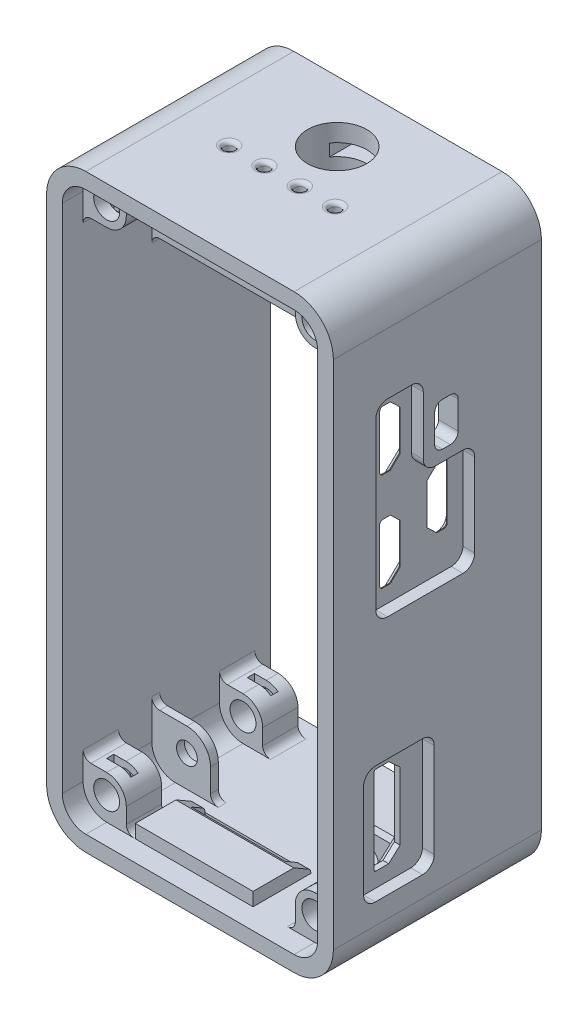
from build123d import *

# Parameters (mm, degrees)
SKETCH1_W               = 31.45
SKETCH1_H               = 73.12
BOSS_EXTRUDE1_DEPTH     = 2
SKETCH3_W               = 31.45
SKETCH3_H               = 73.12
BOSS_EXTRUDE2_DEPTH     = 2
SKETCH4_W               = 36.53
SKETCH4_H               = 31.45
BOSS_EXTRUDE3_DEPTH     = 2
SKETCH5_W               = 36.53
SKETCH5_H               = 31.45
BOSS_EXTRUDE4_DEPTH     = 2
FILLET1_R               = 3
FILLET2_R               = 5
CUT_EXTRUDE1_DEPTH      = 4
CUT_EXTRUDE2_DEPTH      = 1.5
BOSS_EXTRUDE5_DEPTH     = 0.5
BOSS_EXTRUDE6_DEPTH     = 1.13
CHAMFER1_SIZE           = 0.9
SKETCH10_W              = 12
SKETCH10_H              = 1.740840386
CUT_EXTRUDE3_DEPTH      = 3
BOSS_EXTRUDE7_DEPTH     = 1.7
CUT_REVOLVE1_ANGLE      = 90
FILLET4_R               = 0.5
CUT_EXTRUDE4_REACH      = 81.694
SKETCH14_R              = 0.65
FILLET5_R               = 0.5
BOSS_EXTRUDE8_START     = 1
SKETCH16_R              = 1.325
BOSS_EXTRUDE8_DEPTH     = 1
BOSS_EXTRUDE9_DEPTH     = 0.7
SKETCH18_W              = 1.3
SKETCH18_H              = 9.62
CUT_EXTRUDE5_DEPTH      = 1.05
FILLET6_R               = 1
BOSS_EXTRUDE10_START    = 12.119658
BOSS_EXTRUDE10_DEPTH    = 12.119658
CUT_EXTRUDE6_REACH      = 81.694
SKETCH19_R              = 3.770921471
CHAMFER2_SIZE           = 0.5
CUT_EXTRUDE7_REACH      = 53.007
CUT_EXTRUDE7_END_RADIUS = 3.770921471
SKETCH22_W              = 6.22384006
SKETCH22_H              = 1.541488546
SKETCH23_W              = 1.3
SKETCH23_H              = 0.25
CUT_EXTRUDE8_DEPTH      = 5.42
CUT_EXTRUDE9_START      = -4
CUT_EXTRUDE9_DEPTH      = 4
BOSS_EXTRUDE11_DEPTH    = 4.5
FILLET7_R               = 1
SKETCH26_R              = 1.65
CUT_EXTRUDE10_DEPTH     = 4.5
SKETCH27_R              = 1.25
CUT_EXTRUDE11_DEPTH     = 9.319658174
SKETCH28_W              = 3
SKETCH28_H              = 0.918176765
CUT_EXTRUDE12_DEPTH     = 2.5
SKETCH29_W              = 3
SKETCH29_H              = 0.918176765
CUT_EXTRUDE13_DEPTH     = 2.5
CUT_EXTRUDE16_START     = -0.95
CUT_EXTRUDE16_DEPTH     = 0.95
BOSS_EXTRUDE12_START    = 4.5
BOSS_EXTRUDE12_DEPTH    = 4.5
SKETCH32_R              = 1.65
CUT_EXTRUDE17_DEPTH     = 4.5
FILLET8_R               = 1
SKETCH33_W              = 3.09328516
SKETCH33_H              = 0.918176764
CUT_EXTRUDE18_DEPTH     = 2.5
CUT_EXTRUDE19_REACH     = 73.721
SKETCH34_W              = 0.67664258
SKETCH34_H              = 0.918176764
SKETCH35_W              = 3.09328516
SKETCH35_H              = 0.918176764
CUT_EXTRUDE20_DEPTH     = 2.5
CUT_EXTRUDE21_REACH     = 73.796
SKETCH36_W              = 8.9
SKETCH36_H              = 6.619658174
SKETCH37_W              = 15
SKETCH37_H              = 1.7
BOSS_EXTRUDE13_DEPTH    = 1.609159614
CHAMFER3_SIZE           = 1.25
CHAMFER3_SIZE2          = 2.165063509
FILLET9_R               = 0.5


with BuildPart() as part:
    # Sketch1 → Boss-Extrude1 (new body)
    with BuildSketch(Plane(origin=(16.53, 0, 0), x_dir=(0, 0, -1), z_dir=(1, 0, 0))):
        with Locations((3.375, 1.56)):
            Rectangle(SKETCH1_W, SKETCH1_H)
    extrude(amount=BOSS_EXTRUDE1_DEPTH)



with BuildPart() as body_2:
    # Sketch3 → Boss-Extrude2 (new body)
    with BuildSketch(Plane.ZY.offset(16)):
        with Locations((-3.375, 1.56)):
            Rectangle(SKETCH3_W, SKETCH3_H)
    extrude(amount=BOSS_EXTRUDE2_DEPTH)


with BuildPart() as part_1:
    add(part.part)

    add(body_2.part)  # Boss-Extrude3 merges body 2
    # Sketch4 → Boss-Extrude3 (add)
    with BuildSketch(Plane(origin=(0, 38.12, 0), x_dir=(1, 0, 0), z_dir=(0, 1, 0))):
        with Locations((0.265, 3.375)):
            Rectangle(SKETCH4_W, SKETCH4_H)
    extrude(amount=BOSS_EXTRUDE3_DEPTH)

    # Sketch5 → Boss-Extrude4 (add)
    with BuildSketch(Plane.XZ.offset(35)):
        with Locations((0.265, -3.375)):
            Rectangle(SKETCH5_W, SKETCH5_H)
    extrude(amount=-BOSS_EXTRUDE4_DEPTH)

    # Fillet1
    fillet1_edges = [part_1.edges().sort_by_distance(p)[0] for p in [
        (-16, 38.12, -3.375),
        (-16, -33, -3.375),
        (16.53, -33, -3.375),
        (16.53, 38.12, -3.375),
    ]]
    fillet(fillet1_edges, radius=FILLET1_R)

    # Fillet2
    fillet2_edges = [part_1.edges().sort_by_distance(p)[0] for p in [
        (-18, 40.12, -3.375),
        (18.53, 40.12, -3.375),
        (-18, -35, -3.375),
        (18.53, -35, -3.375),
    ]]
    fillet(fillet2_edges, radius=FILLET2_R)

    # Sketch6 → Cut-Extrude1 (cut)
    with BuildSketch(Plane(origin=(18.53, 0, 0), x_dir=(0, 0, -1), z_dir=(1, 0, 0))):
        with BuildLine():
            Line((-4, 24.95), (-4, 18.2))
            ThreePointArc((-4, 18.2), (-3.882842712, 17.917157288), (-3.6, 17.8))
            Line((-3.6, 17.8), (-2.65, 17.8))
            Line((-2.65, 17.8), (-1.4, 19))
            Line((-1.4, 19), (-1.4, 24.15))
            Line((-1.4, 24.15), (-2.65, 25.35))
            Line((-2.65, 25.35), (-3.6, 25.35))
            ThreePointArc((-3.6, 25.35), (-3.882842712, 25.232842712), (-4, 24.95))
        make_face()
        with BuildLine():
            Line((-3.6, 5.3), (-2.65, 5.3))
            Line((-2.65, 5.3), (-1.4, 6.5))
            Line((-1.4, 6.5), (-1.4, 11.65))
            Line((-1.4, 11.65), (-2.65, 12.85))
            Line((-2.65, 12.85), (-3.6, 12.85))
            ThreePointArc((-3.6, 12.85), (-3.882842712, 12.732842712), (-4, 12.45))
            Line((-4, 12.45), (-4, 5.7))
            ThreePointArc((-4, 5.7), (-3.882842712, 5.417157288), (-3.6, 5.3))
        make_face()
        with BuildLine():
            Line((4.2, 15.5), (3.25, 15.5))
            Line((3.25, 15.5), (2, 14.3))
            Line((2, 14.3), (2, 9.15))
            Line((2, 9.15), (3.25, 7.95))
            Line((3.25, 7.95), (4.2, 7.95))
            ThreePointArc((4.2, 7.95), (4.482842712, 8.067157288), (4.6, 8.35))
            Line((4.6, 8.35), (4.6, 15.1))
            ThreePointArc((4.6, 15.1), (4.482842712, 15.382842712), (4.2, 15.5))
        make_face()
        with BuildLine():
            Line((-2.85, -14.25), (-4.5, -14.25))
            ThreePointArc((-4.5, -14.25), (-4.641421356, -14.308578644), (-4.7, -14.45))
            Line((-4.7, -14.45), (-4.7, -25.3))
            ThreePointArc((-4.7, -25.3), (-4.641421356, -25.441421356), (-4.5, -25.5))
            Line((-4.5, -25.5), (-2.85, -25.5))
            Line((-2.85, -25.5), (-1.4, -24.175))
            Line((-1.4, -24.175), (-1.4, -15.575))
            Line((-1.4, -15.575), (-2.85, -14.25))
        make_face()
        with BuildLine():
            Line((1.5, 22.8), (1.5, 19.3))
            ThreePointArc((1.5, 19.3), (1.792893219, 18.592893219), (2.5, 18.3))
            Line((2.5, 18.3), (3.5, 18.3))
            ThreePointArc((3.5, 18.3), (4.207106781, 18.592893219), (4.5, 19.3))
            Line((4.5, 19.3), (4.5, 22.8))
            ThreePointArc((4.5, 22.8), (4.207106781, 23.507106781), (3.5, 23.8))
            Line((3.5, 23.8), (2.5, 23.8))
            ThreePointArc((2.5, 23.8), (1.792893219, 23.507106781), (1.5, 22.8))
        make_face()
    extrude(amount=-CUT_EXTRUDE1_DEPTH, mode=Mode.SUBTRACT)

    # Sketch7 → Cut-Extrude2 (cut)
    with BuildSketch(Plane(origin=(18.53, 0, 0), x_dir=(0, 0, -1), z_dir=(1, 0, 0))):
        with BuildLine():
            Line((0.05, 25.85), (0.05, 18.4))
            ThreePointArc((0.05, 18.4), (0.489339828, 17.339339828), (1.55, 16.9))
            Line((1.55, 16.9), (5.1, 16.9))
            ThreePointArc((5.1, 16.9), (6.160660172, 16.460660172), (6.6, 15.4))
            Line((6.6, 15.4), (6.6, 4.8))
            ThreePointArc((6.6, 4.8), (6.160660172, 3.739339828), (5.1, 3.3))
            Line((5.1, 3.3), (-4.5, 3.3))
            ThreePointArc((-4.5, 3.3), (-5.560660172, 3.739339828), (-6, 4.8))
            Line((-6, 4.8), (-6, 25.85))
            ThreePointArc((-6, 25.85), (-5.560660172, 26.910660172), (-4.5, 27.35))
            Line((-4.5, 27.35), (-1.45, 27.35))
            ThreePointArc((-1.45, 27.35), (-0.389339828, 26.910660172), (0.05, 25.85))
        make_face()
        with BuildLine():
            Line((-6.05, -12.375), (-0.05, -12.375))
            ThreePointArc((-0.05, -12.375), (1.010660172, -12.814339828), (1.45, -13.875))
            Line((1.45, -13.875), (1.45, -25.875))
            ThreePointArc((1.45, -25.875), (1.010660172, -26.935660172), (-0.05, -27.375))
            Line((-0.05, -27.375), (-6.05, -27.375))
            ThreePointArc((-6.05, -27.375), (-7.110660172, -26.935660172), (-7.55, -25.875))
            Line((-7.55, -25.875), (-7.55, -13.875))
            ThreePointArc((-7.55, -13.875), (-7.110660172, -12.814339828), (-6.05, -12.375))
        make_face()
    extrude(amount=-CUT_EXTRUDE2_DEPTH, mode=Mode.SUBTRACT)

    # Sketch8 → Boss-Extrude5 (add)
    with BuildSketch(Plane.ZY.offset(-16.53)):
        with BuildLine():
            Line((7.2, 4.8), (7.2, 25.85))
            ThreePointArc((7.2, 25.85), (6.409188309, 27.759188309), (4.5, 28.55))
            Line((4.5, 28.55), (1.45, 28.55))
            Line((1.45, 28.55), (-5.1, 28.55))
            ThreePointArc((-5.1, 28.55), (-7.009188309, 27.759188309), (-7.8, 25.85))
            Line((-7.8, 25.85), (-7.8, 15.4))
            Line((-7.8, 15.4), (-7.8, 4.8))
            ThreePointArc((-7.8, 4.8), (-7.009188309, 2.890811691), (-5.1, 2.1))
            Line((-5.1, 2.1), (4.5, 2.1))
            ThreePointArc((4.5, 2.1), (6.409188309, 2.890811691), (7.2, 4.8))
        make_face()
        with BuildLine():
            Line((2.65, 25.35), (1.4, 24.15))
            Line((1.4, 24.15), (1.4, 19))
            Line((1.4, 19), (2.65, 17.8))
            Line((2.65, 17.8), (3.6, 17.8))
            ThreePointArc((3.6, 17.8), (3.882842712, 17.917157288), (4, 18.2))
            Line((4, 18.2), (4, 24.95))
            ThreePointArc((4, 24.95), (3.882842712, 25.232842712), (3.6, 25.35))
            Line((3.6, 25.35), (2.65, 25.35))
        make_face(mode=Mode.SUBTRACT)
        with BuildLine():
            Line((1.4, 11.65), (1.4, 6.5))
            Line((1.4, 6.5), (2.65, 5.3))
            Line((2.65, 5.3), (3.6, 5.3))
            ThreePointArc((3.6, 5.3), (3.882842712, 5.417157288), (4, 5.7))
            Line((4, 5.7), (4, 12.45))
            ThreePointArc((4, 12.45), (3.882842712, 12.732842712), (3.6, 12.85))
            Line((3.6, 12.85), (2.65, 12.85))
            Line((2.65, 12.85), (1.4, 11.65))
        make_face(mode=Mode.SUBTRACT)
        with BuildLine():
            Line((-4.2, 7.95), (-3.25, 7.95))
            Line((-3.25, 7.95), (-2, 9.15))
            Line((-2, 9.15), (-2, 14.3))
            Line((-2, 14.3), (-3.25, 15.5))
            Line((-3.25, 15.5), (-4.2, 15.5))
            ThreePointArc((-4.2, 15.5), (-4.482842712, 15.382842712), (-4.6, 15.1))
            Line((-4.6, 15.1), (-4.6, 8.35))
            ThreePointArc((-4.6, 8.35), (-4.482842712, 8.067157288), (-4.2, 7.95))
        make_face(mode=Mode.SUBTRACT)
        with BuildLine():
            Line((-2.5, 18.3), (-3.5, 18.3))
            ThreePointArc((-3.5, 18.3), (-4.207106781, 18.592893219), (-4.5, 19.3))
            Line((-4.5, 19.3), (-4.5, 22.8))
            ThreePointArc((-4.5, 22.8), (-4.207106781, 23.507106781), (-3.5, 23.8))
            Line((-3.5, 23.8), (-2.5, 23.8))
            ThreePointArc((-2.5, 23.8), (-1.792893219, 23.507106781), (-1.5, 22.8))
            Line((-1.5, 22.8), (-1.5, 19.3))
            ThreePointArc((-1.5, 19.3), (-1.792893219, 18.592893219), (-2.5, 18.3))
        make_face(mode=Mode.SUBTRACT)
    extrude(amount=BOSS_EXTRUDE5_DEPTH)

    # Sketch9 → Boss-Extrude6 (add)
    with BuildSketch(Plane.ZY.offset(-16.53)):
        with BuildLine():
            ThreePointArc((-2.65, -25.875), (-1.859188309, -27.784188309), (0.05, -28.575))
            Line((0.05, -28.575), (8.75, -28.575))
            Line((8.75, -28.575), (8.75, -13.875))
            ThreePointArc((8.75, -13.875), (7.959188309, -11.965811691), (6.05, -11.175))
            Line((6.05, -11.175), (0.05, -11.175))
            ThreePointArc((0.05, -11.175), (-1.859188309, -11.965811691), (-2.65, -13.875))
            Line((-2.65, -13.875), (-2.65, -25.875))
        make_face()
        with BuildLine():
            Line((2.85, -25.5), (1.4, -24.175))
            Line((1.4, -24.175), (1.4, -15.575))
            Line((1.4, -15.575), (2.85, -14.25))
            Line((2.85, -14.25), (4.5, -14.25))
            ThreePointArc((4.5, -14.25), (4.641421356, -14.308578644), (4.7, -14.45))
            Line((4.7, -14.45), (4.7, -25.3))
            ThreePointArc((4.7, -25.3), (4.641421356, -25.441421356), (4.5, -25.5))
            Line((4.5, -25.5), (2.85, -25.5))
        make_face(mode=Mode.SUBTRACT)
    extrude(amount=BOSS_EXTRUDE6_DEPTH)

    # Chamfer1
    chamfer1_edges = [part_1.edges().sort_by_distance(p)[0] for p in [
        (16.03, 25.35, 3.125),
        (16.03, 24.75, 2.025),
        (16.03, 21.575, 1.4),
        (16.03, 18.4, 2.025),
        (16.03, 17.8, 3.125),
        (16.03, 17.917157288, 3.882842712),
        (16.03, 21.575, 4),
        (16.03, 25.232842712, 3.882842712),
        (16.03, 12.25, 2.025),
        (16.03, 9.075, 1.4),
        (16.03, 5.9, 2.025),
        (16.03, 5.3, 3.125),
        (16.03, 5.417157288, 3.882842712),
        (16.03, 9.075, 4),
        (16.03, 12.732842712, 3.882842712),
        (16.03, 12.85, 3.125),
        (16.03, 8.067157288, -4.482842712),
        (16.03, 7.95, -3.725),
        (16.03, 8.55, -2.625),
        (16.03, 11.725, -2),
        (16.03, 14.9, -2.625),
        (16.03, 15.5, -3.725),
        (16.03, 15.382842712, -4.482842712),
        (16.03, 11.725, -4.6),
        (15.4, -14.9125, 2.125),
        (15.4, -14.25, 3.675),
        (15.4, -14.308578644, 4.641421356),
        (15.4, -19.875, 4.7),
        (15.4, -25.441421356, 4.641421356),
        (15.4, -25.5, 3.675),
        (15.4, -24.8375, 2.125),
        (15.4, -19.875, 1.4),
    ]]
    chamfer(chamfer1_edges, length=CHAMFER1_SIZE)

    # Sketch10 → Cut-Extrude3 (cut)
    with BuildSketch(Plane.XZ.offset(35)):
        with Locations((-1.85, 2.270420193)):
            Rectangle(SKETCH10_W, SKETCH10_H)
    extrude(amount=-CUT_EXTRUDE3_DEPTH, mode=Mode.SUBTRACT)

    # Sketch11 → Boss-Extrude7 (add)
    with BuildSketch(Plane(origin=(0, -33, 0), x_dir=(1, 0, 0), z_dir=(0, 1, 0))):
        Polygon((5.65, -7.140840386), (-9.35, -7.140840386), (-9.35, -1.4), (-7.85, -1.4), (-7.85, -3.140840386), (4.15, -3.140840386), (4.15, -1.4), (5.65, -1.4), align=None)
    extrude(amount=BOSS_EXTRUDE7_DEPTH)

    # Sketch12 → Cut-Revolve1 (revolve, cut)
    with BuildSketch(Plane(origin=(0, 0, 3.140840386), x_dir=(-1, 0, 0), z_dir=(0, 0, -1))):
        with BuildLine():
            Line((9.408896713, -39.597490568), (-5.708896713, -39.597490568))
            ThreePointArc((-5.708896713, -39.597490568), (1.85, -32.038593855), (9.408896713, -39.597490568))
        make_face()
    revolve(axis=Axis((-9.408896713, -39.597490568, 3.140840386), (1, 0, 0)), revolution_arc=CUT_REVOLVE1_ANGLE, mode=Mode.SUBTRACT)

    # Fillet4
    # the kernel refuses this fillet: 0.5 mm, written as the material it takes off along each edge
    with BuildSketch(Plane(origin=(-1.85, -39.597490568, 3.140840386), x_dir=(0.8806810287344635, 0.4737097482923559, 0), z_dir=(0.4737097482923559, -0.8806810287344635, 0))) as fillet4_piece_1_section:
        with BuildLine():
            CenterArc((8.04337095, 0.5), FILLET4_R, 183.55709994, 86.44290006)
            Line((8.04337095, 0), (7.558896713, 0))
            ThreePointArc((7.558896713, 0), (7.555255213, 0.234602212), (7.544334218, 0.468978384))
        make_face()
    fillet4_piece_1 = revolve(axis=Axis((-1.85, -39.597490568, 3.140840386), (0, 0, 1)), revolution_arc=123.449249866, mode=Mode.PRIVATE)
    fillet4_piece_1 = split(fillet4_piece_1, bisect_by=Plane(origin=(-7.85, -31.902523218, 3.270106468), z_dir=(1, 0, 0)), keep=Keep.TOP, mode=Mode.PRIVATE)
    fillet4_piece_1 = split(fillet4_piece_1, bisect_by=Plane(origin=(4.15, -31.902523218, 3.270106468), z_dir=(-1, 0, 0)), keep=Keep.TOP, mode=Mode.PRIVATE)
    add(fillet4_piece_1, mode=Mode.SUBTRACT)

    # Sketch14 → Cut-Extrude4 (cut, up to next)
    with BuildSketch(Plane(origin=(0, 40.12, 0), x_dir=(1, 0, 0), z_dir=(0, 1, 0)), mode=Mode.PRIVATE) as cut_extrude4_sk1:
        with Locations(Location((6.75, 0.6, 0), (0, 0, 270))):
            Circle(SKETCH14_R)
    cut_extrude4_tool1 = extrude(cut_extrude4_sk1.sketch, amount=-CUT_EXTRUDE4_REACH, mode=Mode.PRIVATE) & part_1.part
    # Sketch14 → Cut-Extrude4 (cut, up to next)
    with BuildSketch(Plane(origin=(0, 40.12, 0), x_dir=(1, 0, 0), z_dir=(0, 1, 0)), mode=Mode.PRIVATE) as cut_extrude4_sk2:
        with Locations(Location((2.25, 0.6, 0), (0, 0, 270))):
            Circle(SKETCH14_R)
    cut_extrude4_tool2 = extrude(cut_extrude4_sk2.sketch, amount=-CUT_EXTRUDE4_REACH, mode=Mode.PRIVATE) & part_1.part
    # Sketch14 → Cut-Extrude4 (cut, up to next)
    with BuildSketch(Plane(origin=(0, 40.12, 0), x_dir=(1, 0, 0), z_dir=(0, 1, 0)), mode=Mode.PRIVATE) as cut_extrude4_sk3:
        with Locations(Location((-2.25, 0.6, 0), (0, 0, 270))):
            Circle(SKETCH14_R)
    cut_extrude4_tool3 = extrude(cut_extrude4_sk3.sketch, amount=-CUT_EXTRUDE4_REACH, mode=Mode.PRIVATE) & part_1.part
    # Sketch14 → Cut-Extrude4 (cut, up to next)
    with BuildSketch(Plane(origin=(0, 40.12, 0), x_dir=(1, 0, 0), z_dir=(0, 1, 0)), mode=Mode.PRIVATE) as cut_extrude4_sk4:
        with Locations(Location((-6.75, 0.6, 0), (0, 0, 270))):
            Circle(SKETCH14_R)
    cut_extrude4_tool4 = extrude(cut_extrude4_sk4.sketch, amount=-CUT_EXTRUDE4_REACH, mode=Mode.PRIVATE) & part_1.part
    add(cut_extrude4_tool1.solids().sort_by_distance((6.75, 40.12, -0.6))[0], mode=Mode.SUBTRACT)
    add(cut_extrude4_tool2.solids().sort_by_distance((2.25, 40.12, -0.6))[0], mode=Mode.SUBTRACT)
    add(cut_extrude4_tool3.solids().sort_by_distance((-2.25, 40.12, -0.6))[0], mode=Mode.SUBTRACT)
    add(cut_extrude4_tool4.solids().sort_by_distance((-6.75, 40.12, -0.6))[0], mode=Mode.SUBTRACT)

    # Fillet5
    fillet5_edges = [part_1.edges().sort_by_distance(p)[0] for p in [
        (6.75, 40.12, -1.25),
        (2.25, 40.12, -1.25),
        (-2.25, 40.12, -1.25),
        (-6.75, 40.12, -1.25),
    ]]
    fillet(fillet5_edges, radius=FILLET5_R)

    # Sketch16 → Boss-Extrude8 (add)
    # profile 1 of 3: a face of its own
    with BuildSketch(Plane(origin=(0, 0, 0), x_dir=(-1, 0, 0), z_dir=(0, 0, -1)).offset(BOSS_EXTRUDE8_START)):
        with BuildLine():
            Line((-13.53, 38.12), (13, 38.12))
            ThreePointArc((13, 38.12), (15.121320344, 37.241320344), (16, 35.12))
            Line((16, 35.12), (16, 26.025))
            Line((16, 26.025), (-16.53, 26.025))
            Line((-16.53, 26.025), (-16.53, 35.12))
            ThreePointArc((-16.53, 35.12), (-15.651320344, 37.241320344), (-13.53, 38.12))
        make_face()
        with Locations(Location((-11.525, 29.025, 0), (0, 0, 90))):
            Circle(SKETCH16_R, mode=Mode.SUBTRACT)
        with Locations(Location((11.525, 29.025, 0), (0, 0, 90))):
            Circle(SKETCH16_R, mode=Mode.SUBTRACT)
    # profile 2 of 3: a face of its own
    with BuildSketch(Plane(origin=(0, 0, 0), x_dir=(-1, 0, 0), z_dir=(0, 0, -1)).offset(BOSS_EXTRUDE8_START)):
        with BuildLine():
            Line((-16.53, -30), (-16.53, -26.025))
            Line((-16.53, -26.025), (-11.525, -26.025))
            ThreePointArc((-11.525, -26.025), (-9.403679656, -26.903679656), (-8.525, -29.025))
            Line((-8.525, -29.025), (-8.525, -33))
            Line((-8.525, -33), (-13.53, -33))
            ThreePointArc((-13.53, -33), (-15.651320344, -32.121320344), (-16.53, -30))
        make_face()
        with Locations(Location((-11.525, -29.025, 0), (0, 0, 90))):
            Circle(SKETCH16_R, mode=Mode.SUBTRACT)
    # profile 3 of 3: a face of its own
    with BuildSketch(Plane(origin=(0, 0, 0), x_dir=(-1, 0, 0), z_dir=(0, 0, -1)).offset(BOSS_EXTRUDE8_START)):
        with BuildLine():
            Line((13, -33), (8.525, -33))
            Line((8.525, -33), (8.525, -29.025))
            ThreePointArc((8.525, -29.025), (9.403679656, -26.903679656), (11.525, -26.025))
            Line((11.525, -26.025), (16, -26.025))
            Line((16, -26.025), (16, -30))
            ThreePointArc((16, -30), (15.121320344, -32.121320344), (13, -33))
        make_face()
        with Locations(Location((11.525, -29.025, 0), (0, 0, 90))):
            Circle(SKETCH16_R, mode=Mode.SUBTRACT)
    extrude(amount=-BOSS_EXTRUDE8_DEPTH)

    # Sketch17 → Boss-Extrude9 (add)
    with BuildSketch(Plane.XY):
        with BuildLine():
            Line((16.53, 32.7), (-16, 32.7))
            Line((-16, 32.7), (-16, 35.12))
            ThreePointArc((-16, 35.12), (-15.121320344, 37.241320344), (-13, 38.12))
            Line((-13, 38.12), (13.53, 38.12))
            ThreePointArc((13.53, 38.12), (15.651320344, 37.241320344), (16.53, 35.12))
            Line((16.53, 35.12), (16.53, 32.7))
        make_face()
    extrude(amount=BOSS_EXTRUDE9_DEPTH)

    # Sketch18 → Cut-Extrude5 (cut)
    with BuildSketch(Plane(origin=(0, 0, -1), x_dir=(-1, 0, 0), z_dir=(0, 0, -1))):
        with Locations((6.75, 33.31)):
            Rectangle(SKETCH18_W, SKETCH18_H)
        with Locations((2.25, 33.31)):
            Rectangle(SKETCH18_W, SKETCH18_H)
        with Locations((-2.25, 33.31)):
            Rectangle(SKETCH18_W, SKETCH18_H)
        with Locations((-6.75, 33.31)):
            Rectangle(SKETCH18_W, SKETCH18_H)
    extrude(amount=-CUT_EXTRUDE5_DEPTH, mode=Mode.SUBTRACT)

    # Fillet6
    fillet6_edges = [part_1.edges().sort_by_distance(p)[0] for p in [
        (16.03, 26.025, -0.5),
        (-16, 26.025, -0.5),
        (15.4, -26.025, -0.5),
        (8.525, -33, -0.5),
        (-16, -26.025, -0.5),
        (-8.525, -33, -0.5),
    ]]
    fillet(fillet6_edges, radius=FILLET6_R)

    # Sketch21 → Boss-Extrude10 (add)
    with BuildSketch(Plane(origin=(0, 0, -1), x_dir=(-1, 0, 0), z_dir=(0, 0, -1)).offset(BOSS_EXTRUDE10_START)):
        with BuildLine():
            Line((-16.53, 35.12), (-16.53, 32.7))
            Line((-16.53, 32.7), (16, 32.7))
            Line((16, 32.7), (16, 35.12))
            ThreePointArc((16, 35.12), (15.121320344, 37.241320344), (13, 38.12))
            Line((13, 38.12), (-13.53, 38.12))
            ThreePointArc((-13.53, 38.12), (-15.651320344, 37.241320344), (-16.53, 35.12))
        make_face()
    extrude(amount=-BOSS_EXTRUDE10_DEPTH)

    # Sketch19 → Cut-Extrude6 (cut, up to next)
    with BuildSketch(Plane(origin=(0, 40.12, 0), x_dir=(1, 0, 0), z_dir=(0, 1, 0)), mode=Mode.PRIVATE) as cut_extrude6_sk1:
        with Locations(Location((0.265, 7.348736703, 0), (0, 0, 270))):
            Circle(SKETCH19_R)
    cut_extrude6_tool1 = extrude(cut_extrude6_sk1.sketch, amount=-CUT_EXTRUDE6_REACH, mode=Mode.PRIVATE) & part_1.part
    add(cut_extrude6_tool1.solids().sort_by_distance((0.265, 40.12, -7.348737))[0], mode=Mode.SUBTRACT)

    # Chamfer2
    chamfer2_edges = [part_1.edges().sort_by_distance(p)[0] for p in [
        (0.265, 32.7, -11.119658174),
    ]]
    chamfer(chamfer2_edges, length=CHAMFER2_SIZE)

    # Cut-Extrude7: up to this cylinder (the profile starts outside it)
    cut_extrude7_end = Plane(origin=(0.265, 37.12, -7.348736703), z_dir=(0, 1, 0)) * Cylinder(CUT_EXTRUDE7_END_RADIUS, 114.555842941, mode=Mode.PRIVATE)
    # Sketch22 → Cut-Extrude7 (cut, up to the surface)
    with BuildSketch(Plane(origin=(0, 0, -13.119658174), x_dir=(-1, 0, 0), z_dir=(0, 0, -1)), mode=Mode.PRIVATE) as cut_extrude7_sk1:
        with Locations((-0.265, 37.12)):
            Rectangle(SKETCH22_W, SKETCH22_H)
    cut_extrude7_tool1 = extrude(cut_extrude7_sk1.sketch, amount=-CUT_EXTRUDE7_REACH, mode=Mode.PRIVATE) - cut_extrude7_end
    add(cut_extrude7_tool1.solids().sort_by_distance((0.265, 37.12, -13.119658))[0], mode=Mode.SUBTRACT)

    # Sketch23 → Cut-Extrude8 (cut)
    with BuildSketch(Plane.XZ.offset(-32.7)):
        with Locations((6.75, -1.125)):
            Rectangle(SKETCH23_W, SKETCH23_H)
        with Locations((2.25, -1.125)):
            Rectangle(SKETCH23_W, SKETCH23_H)
        with Locations((-2.25, -1.125)):
            Rectangle(SKETCH23_W, SKETCH23_H)
        with Locations((-6.75, -1.125)):
            Rectangle(SKETCH23_W, SKETCH23_H)
    extrude(amount=-CUT_EXTRUDE8_DEPTH, mode=Mode.SUBTRACT)

    # Sketch24 → Cut-Extrude9 (cut)
    with BuildSketch(Plane(origin=(0, 0, -19.1), x_dir=(-1, 0, 0), z_dir=(0, 0, -1)).offset(CUT_EXTRUDE9_START)):
        with BuildLine():
            Line((-13.53, -35), (13, -35))
            ThreePointArc((13, -35), (16.535533906, -33.535533906), (18, -30))
            Line((18, -30), (18, 35.12))
            ThreePointArc((18, 35.12), (16.535533906, 38.655533906), (13, 40.12))
            Line((13, 40.12), (-13.53, 40.12))
            ThreePointArc((-13.53, 40.12), (-17.065533906, 38.655533906), (-18.53, 35.12))
            Line((-18.53, 35.12), (-18.53, -30))
            ThreePointArc((-18.53, -30), (-17.065533906, -33.535533906), (-13.53, -35))
        make_face()
    extrude(amount=CUT_EXTRUDE9_DEPTH, mode=Mode.SUBTRACT)

    # Sketch25 → Boss-Extrude11 (add)
    with BuildSketch(Plane(origin=(0, 0, -13.119658174), x_dir=(-1, 0, 0), z_dir=(0, 0, -1))):
        with BuildLine():
            Line((13, 32.62), (16, 32.62))
            Line((16, 32.62), (16, 35.12))
            ThreePointArc((16, 35.12), (15.121320344, 37.241320344), (13, 38.12))
            Line((13, 38.12), (10.5, 38.12))
            Line((10.5, 38.12), (10.5, 35.12))
            ThreePointArc((10.5, 35.12), (11.232233047, 33.352233047), (13, 32.62))
        make_face()
        with BuildLine():
            Line((16, -27.5), (16, -30))
            ThreePointArc((16, -30), (15.121320344, -32.121320344), (13, -33))
            Line((13, -33), (10.5, -33))
            Line((10.5, -33), (10.5, -30))
            ThreePointArc((10.5, -30), (11.232233047, -28.232233047), (13, -27.5))
            Line((13, -27.5), (16, -27.5))
        make_face()
        with BuildLine():
            Line((-16.53, -27.5), (-13.53, -27.5))
            ThreePointArc((-13.53, -27.5), (-11.762233047, -28.232233047), (-11.03, -30))
            Line((-11.03, -30), (-11.03, -33))
            Line((-11.03, -33), (-13.53, -33))
            ThreePointArc((-13.53, -33), (-15.651320344, -32.121320344), (-16.53, -30))
            Line((-16.53, -30), (-16.53, -27.5))
        make_face()
        with BuildLine():
            Line((-11.03, 38.12), (-13.53, 38.12))
            ThreePointArc((-13.53, 38.12), (-15.651320344, 37.241320344), (-16.53, 35.12))
            Line((-16.53, 35.12), (-16.53, 32.62))
            Line((-16.53, 32.62), (-13.53, 32.62))
            ThreePointArc((-13.53, 32.62), (-11.762233047, 33.352233047), (-11.03, 35.12))
            Line((-11.03, 35.12), (-11.03, 38.12))
        make_face()
    extrude(amount=-BOSS_EXTRUDE11_DEPTH)

    # Fillet7
    fillet7_edges = [part_1.edges().sort_by_distance(p)[0] for p in [
        (16.53, 32.62, -10.869658174),
        (11.03, -33, -10.869658174),
        (16.53, -27.5, -10.869658174),
        (-16, 32.62, -10.869658174),
        (-16, -27.5, -10.869658174),
        (-10.5, -33, -10.869658174),
    ]]
    fillet(fillet7_edges, radius=FILLET7_R)

    # Sketch26 → Cut-Extrude10 (cut)
    with BuildSketch(Plane(origin=(0, 0, -13.119658174), x_dir=(-1, 0, 0), z_dir=(0, 0, -1))):
        with Locations(Location((13, 35.12, 0), (0, 0, 90))):
            Circle(SKETCH26_R)
        with Locations(Location((-13.53, 35.12, 0), (0, 0, 90))):
            Circle(SKETCH26_R)
        with Locations(Location((13, -30, 0), (0, 0, 90))):
            Circle(SKETCH26_R)
        with Locations(Location((-13.53, -30, 0), (0, 0, 90))):
            Circle(SKETCH26_R)
    extrude(amount=-CUT_EXTRUDE10_DEPTH, mode=Mode.SUBTRACT)

    # Sketch27 → Cut-Extrude11 (cut)
    with BuildSketch(Plane(origin=(0, 0, -8.619658174), x_dir=(-1, 0, 0), z_dir=(0, 0, -1))):
        with Locations(Location((13, 35.12, 0), (0, 0, 90))):
            Circle(SKETCH27_R)
        with Locations(Location((-13.53, 35.12, 0), (0, 0, 90))):
            Circle(SKETCH27_R)
    extrude(amount=-CUT_EXTRUDE11_DEPTH, mode=Mode.SUBTRACT)

    # Sketch28 → Cut-Extrude12 (cut)
    with BuildSketch(Plane.XZ.offset(-32.62)):
        with Locations((-13, -11.119658173)):
            Rectangle(SKETCH28_W, SKETCH28_H)
        with Locations((13.53, -11.119658173)):
            Rectangle(SKETCH28_W, SKETCH28_H)
    extrude(amount=-CUT_EXTRUDE12_DEPTH, mode=Mode.SUBTRACT)

    # Sketch29 → Cut-Extrude13 (cut)
    with BuildSketch(Plane(origin=(0, -27.5, 0), x_dir=(1, 0, 0), z_dir=(0, 1, 0))):
        with Locations((-13, 11.119658173)):
            Rectangle(SKETCH29_W, SKETCH29_H)
        with Locations((13.53, 11.119658173)):
            Rectangle(SKETCH29_W, SKETCH29_H)
    extrude(amount=-CUT_EXTRUDE13_DEPTH, mode=Mode.SUBTRACT)

    # Sketch30 → Cut-Extrude16 (cut)
    with BuildSketch(Plane.XY.offset(12.35).offset(CUT_EXTRUDE16_START)):
        with BuildLine():
            Line((-18, 35.12), (-18, -30))
            ThreePointArc((-18, -30), (-16.535533906, -33.535533906), (-13, -35))
            Line((-13, -35), (13.53, -35))
            ThreePointArc((13.53, -35), (17.065533906, -33.535533906), (18.53, -30))
            Line((18.53, -30), (18.53, 35.12))
            ThreePointArc((18.53, 35.12), (17.065533906, 38.655533906), (13.53, 40.12))
            Line((13.53, 40.12), (-13, 40.12))
            ThreePointArc((-13, 40.12), (-16.535533906, 38.655533906), (-18, 35.12))
        make_face()
    extrude(amount=CUT_EXTRUDE16_DEPTH, mode=Mode.SUBTRACT)

    # Sketch31 → Boss-Extrude12 (add)
    with BuildSketch(Plane(origin=(0, 0, 8.75), x_dir=(-1, 0, 0), z_dir=(0, 0, -1)).offset(BOSS_EXTRUDE12_START)):
        with BuildLine():
            Line((-11.03, 35.12), (-11.03, 38.12))
            Line((-11.03, 38.12), (-13.53, 38.12))
            ThreePointArc((-13.53, 38.12), (-15.651320344, 37.241320344), (-16.53, 35.12))
            Line((-16.53, 35.12), (-16.53, 32.62))
            Line((-16.53, 32.62), (-13.53, 32.62))
            ThreePointArc((-13.53, 32.62), (-11.762233047, 33.352233047), (-11.03, 35.12))
        make_face()
        with BuildLine():
            Line((-16.53, -27.5), (-16.53, -30))
            ThreePointArc((-16.53, -30), (-15.651320344, -32.121320344), (-13.53, -33))
            Line((-13.53, -33), (-11.03, -33))
            Line((-11.03, -33), (-11.03, -30))
            ThreePointArc((-11.03, -30), (-11.762233047, -28.232233047), (-13.53, -27.5))
            Line((-13.53, -27.5), (-16.53, -27.5))
        make_face()
        with BuildLine():
            Line((13, 32.62), (16, 32.62))
            Line((16, 32.62), (16, 35.12))
            ThreePointArc((16, 35.12), (15.121320344, 37.241320344), (13, 38.12))
            Line((13, 38.12), (10.5, 38.12))
            Line((10.5, 38.12), (10.5, 35.12))
            ThreePointArc((10.5, 35.12), (11.232233047, 33.352233047), (13, 32.62))
        make_face()
        with BuildLine():
            Line((10.5, -33), (13, -33))
            ThreePointArc((13, -33), (15.121320344, -32.121320344), (16, -30))
            Line((16, -30), (16, -27.5))
            Line((16, -27.5), (13, -27.5))
            ThreePointArc((13, -27.5), (11.232233047, -28.232233047), (10.5, -30))
            Line((10.5, -30), (10.5, -33))
        make_face()
    extrude(amount=-BOSS_EXTRUDE12_DEPTH)

    # Sketch32 → Cut-Extrude17 (cut)
    with BuildSketch(Plane(origin=(0, 0, 4.25), x_dir=(-1, 0, 0), z_dir=(0, 0, -1))):
        with Locations(Location((-13.53, -30, 0), (0, 0, 90))):
            Circle(SKETCH32_R)
        with Locations(Location((13, -30, 0), (0, 0, 90))):
            Circle(SKETCH32_R)
        with Locations(Location((-13.53, 35.12, 0), (0, 0, 90))):
            Circle(SKETCH32_R)
        with Locations(Location((13, 35.12, 0), (0, 0, 90))):
            Circle(SKETCH32_R)
    extrude(amount=-CUT_EXTRUDE17_DEPTH, mode=Mode.SUBTRACT)

    # Fillet8
    fillet8_edges = [part_1.edges().sort_by_distance(p)[0] for p in [
        (11.03, 38.12, 6.5),
        (16.53, 32.62, 6.5),
        (15.4, -27.5, 6.5),
        (11.03, -33, 6.5),
        (-10.5, 38.12, 6.5),
        (-16, 32.62, 6.5),
        (-16, -27.5, 6.5),
        (-10.5, -33, 6.5),
    ]]
    fillet(fillet8_edges, radius=FILLET8_R)

    # Sketch33 → Cut-Extrude18 (cut)
    with BuildSketch(Plane(origin=(0, -27.5, 0), x_dir=(1, 0, 0), z_dir=(0, 1, 0))):
        with Locations((13.53, -6.75)):
            Rectangle(SKETCH33_W, SKETCH33_H)
        with Locations((-13, -6.75)):
            Rectangle(SKETCH33_W, SKETCH33_H)
    extrude(amount=-CUT_EXTRUDE18_DEPTH, mode=Mode.SUBTRACT)

    # Sketch34 → Cut-Extrude19 (cut, up to next)
    with BuildSketch(Plane.XZ.offset(27.5), mode=Mode.PRIVATE) as cut_extrude19_sk1:
        with Locations((14.73832129, 6.75)):
            Rectangle(SKETCH34_W, SKETCH34_H)
    cut_extrude19_tool1 = extrude(cut_extrude19_sk1.sketch, amount=-CUT_EXTRUDE19_REACH, mode=Mode.PRIVATE) & part_1.part
    add(cut_extrude19_tool1.solids().sort_by_distance((14.738321, -27.5, 6.75))[0], mode=Mode.SUBTRACT)

    # Sketch35 → Cut-Extrude20 (cut)
    with BuildSketch(Plane.XZ.offset(-32.62)):
        with Locations((-13, 6.75)):
            Rectangle(SKETCH35_W, SKETCH35_H)
        with Locations((13.53, 6.75)):
            Rectangle(SKETCH35_W, SKETCH35_H)
    extrude(amount=-CUT_EXTRUDE20_DEPTH, mode=Mode.SUBTRACT)

    # Cut-Extrude21: up to this face of the body (flat: up to its plane)
    cut_extrude21_end = Plane(part_1.part.faces().sort_by_distance((0.265, 38.12, 5.993832691))[0])
    # Sketch36 → Cut-Extrude21 (cut, up to the picked face)
    with BuildSketch(Plane.XZ.offset(-32.7), mode=Mode.PRIVATE) as cut_extrude21_sk1:
        with Locations((10.55, -5.309829087)):
            Rectangle(SKETCH36_W, SKETCH36_H)
    cut_extrude21_tool1 = split(extrude(cut_extrude21_sk1.sketch, amount=-CUT_EXTRUDE21_REACH, mode=Mode.PRIVATE), bisect_by=cut_extrude21_end, keep=Keep.BOTH, mode=Mode.PRIVATE)
    # Sketch36 → Cut-Extrude21 (cut, up to the picked face)
    with BuildSketch(Plane.XZ.offset(-32.7), mode=Mode.PRIVATE) as cut_extrude21_sk2:
        with Locations((-10.02, -5.309829087)):
            Rectangle(SKETCH36_W, SKETCH36_H)
    cut_extrude21_tool2 = split(extrude(cut_extrude21_sk2.sketch, amount=-CUT_EXTRUDE21_REACH, mode=Mode.PRIVATE), bisect_by=cut_extrude21_end, keep=Keep.BOTH, mode=Mode.PRIVATE)
    add(cut_extrude21_tool1.solids().sort_by(Axis((10.55, 32.7, -5.309829), (0, 1, 0)))[0], mode=Mode.SUBTRACT)
    add(cut_extrude21_tool2.solids().sort_by(Axis((-10.02, 32.7, -5.309829), (0, 1, 0)))[0], mode=Mode.SUBTRACT)

    # Sketch37 → Boss-Extrude13 (add)
    with BuildSketch(Plane.XY.offset(7.140840386)):
        with Locations((-1.85, -32.15)):
            Rectangle(SKETCH37_W, SKETCH37_H)
    extrude(amount=BOSS_EXTRUDE13_DEPTH)

    # Chamfer3
    chamfer3_edges = [part_1.edges().sort_by_distance(p)[0] for p in [
        (-8.6, -31.3, 1.4),
    ]]
    chamfer3_side = [part_1.faces().sort_by_distance(p)[0] for p in [
        (-8.6, -32.15, 1.4),
    ]]
    chamfer(chamfer3_edges, length=CHAMFER3_SIZE, length2=CHAMFER3_SIZE2, reference=chamfer3_side[0])

    # Fillet9
    fillet9_edges = [part_1.edges().sort_by_distance(p)[0] for p in [
        (4.9, -32.55, 1.4),
        (-8.6, -32.55, 1.4),
    ]]
    fillet(fillet9_edges, radius=FILLET9_R)


solid = part_1.part
